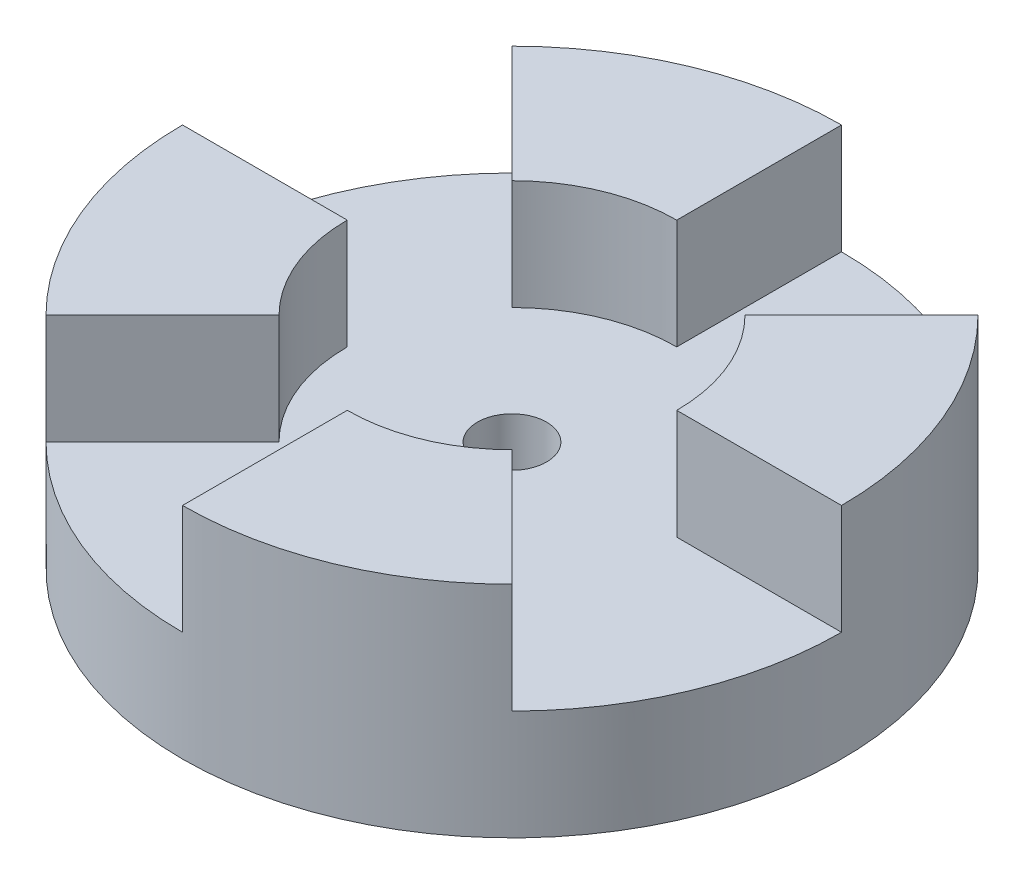
from build123d import *

# Parameters (mm, degrees)
SKETCH1_R           = 38.1
BOSS_EXTRUDE1_DEPTH = 12.7
SKETCH2_R           = 4.0005
CUT_EXTRUDE1_DEPTH  = 12.7
BOSS_EXTRUDE2_DEPTH = 12.7
SKETCH5_R           = 5.334
CUT_EXTRUDE2_DEPTH  = 2.54


with BuildPart() as part:
    # Sketch1 → Boss-Extrude1 (new body)
    with BuildSketch(Plane(origin=(0, 0, 0), x_dir=(1, 0, 0), z_dir=(0, 1, 0))):
        with Locations((-80.789858777, -8.415610289)):
            Circle(SKETCH1_R)
    extrude(amount=BOSS_EXTRUDE1_DEPTH)

    # Sketch2 → Cut-Extrude1 (cut)
    with BuildSketch(Plane(origin=(0, 12.7, 0), x_dir=(1, 0, 0), z_dir=(0, 1, 0))):
        with Locations((-80.789858777, -8.415610289)):
            Circle(SKETCH2_R)
    extrude(amount=-CUT_EXTRUDE1_DEPTH, mode=Mode.SUBTRACT)

    # Sketch3 → Boss-Extrude2 (add)
    with BuildSketch(Plane(origin=(0, 12.7, 0), x_dir=(1, 0, 0), z_dir=(0, 1, 0))):
        with BuildLine():
            Line((-53.849090413, 18.525158074), (-67.319474595, 5.054773892))
            ThreePointArc((-67.319474595, 5.054773892), (-63.189953682, -1.125490903), (-61.739858777, -8.415610289))
            Line((-61.739858777, -8.415610289), (-42.689858777, -8.415610289))
            ThreePointArc((-42.689858777, -8.415610289), (-45.590048588, 6.164628484), (-53.849090413, 18.525158074))
        make_face()
        with BuildLine():
            ThreePointArc((-94.260242958, 5.054773892), (-88.079978163, 9.184294805), (-80.789858777, 10.634389711))
            Line((-80.789858777, 10.634389711), (-80.789858777, 29.684389711))
            ThreePointArc((-80.789858777, 29.684389711), (-95.37009755, 26.784199899), (-107.73062714, 18.525158074))
            Line((-107.73062714, 18.525158074), (-94.260242958, 5.054773892))
        make_face()
        with BuildLine():
            Line((-53.849090413, -35.356378652), (-67.319474595, -21.885994471))
            ThreePointArc((-67.319474595, -21.885994471), (-73.49973939, -26.015515384), (-80.789858777, -27.465610289))
            Line((-80.789858777, -27.465610289), (-80.789858777, -46.515610289))
            ThreePointArc((-80.789858777, -46.515610289), (-66.209620003, -43.615420478), (-53.849090413, -35.356378652))
        make_face()
        with BuildLine():
            ThreePointArc((-94.260242958, -21.885994471), (-98.389763871, -15.705729676), (-99.839858777, -8.415610289))
            Line((-99.839858777, -8.415610289), (-118.889858777, -8.415610289))
            ThreePointArc((-118.889858777, -8.415610289), (-115.989668965, -22.995849062), (-107.73062714, -35.356378652))
            Line((-107.73062714, -35.356378652), (-94.260242958, -21.885994471))
        make_face()
    extrude(amount=BOSS_EXTRUDE2_DEPTH)

    # Sketch5 → Cut-Extrude2 (cut)
    with BuildSketch(Plane.XZ):
        with Locations((-80.789858777, 8.415610289)):
            Circle(SKETCH5_R)
    extrude(amount=-CUT_EXTRUDE2_DEPTH, mode=Mode.SUBTRACT)


solid = part.part
